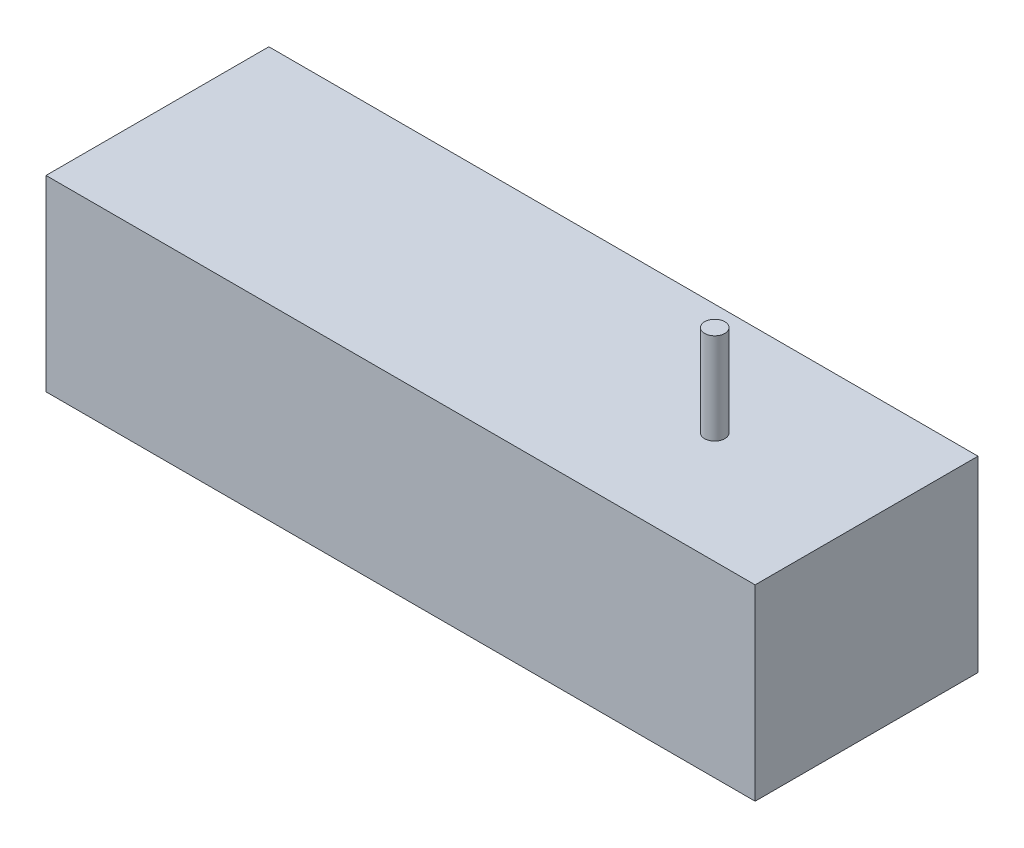
from build123d import *

# Parameters (mm, degrees)
SKETCH_2_W      = 70
SKETCH_2_H      = 22
EXTRUDE_1_DEPTH = 18.5
SKETCH_3_R      = 1
EXTRUDE_2_DEPTH = 9


with BuildPart() as part:
    # 草圖2 → 填料-伸長1 (new body)
    with BuildSketch(Plane(origin=(0, 0, 0), x_dir=(1, 0, 0), z_dir=(0, 1, 0))):
        Rectangle(SKETCH_2_W, SKETCH_2_H)
    extrude(amount=EXTRUDE_1_DEPTH)

    # 草圖3 → 填料-伸長2 (add)
    with BuildSketch(Plane(origin=(0, 18.5, 0), x_dir=(1, 0, 0), z_dir=(0, 1, 0))):
        with Locations((20.011320948, 0)):
            Circle(SKETCH_3_R)
    extrude(amount=EXTRUDE_2_DEPTH)


solid = part.part
